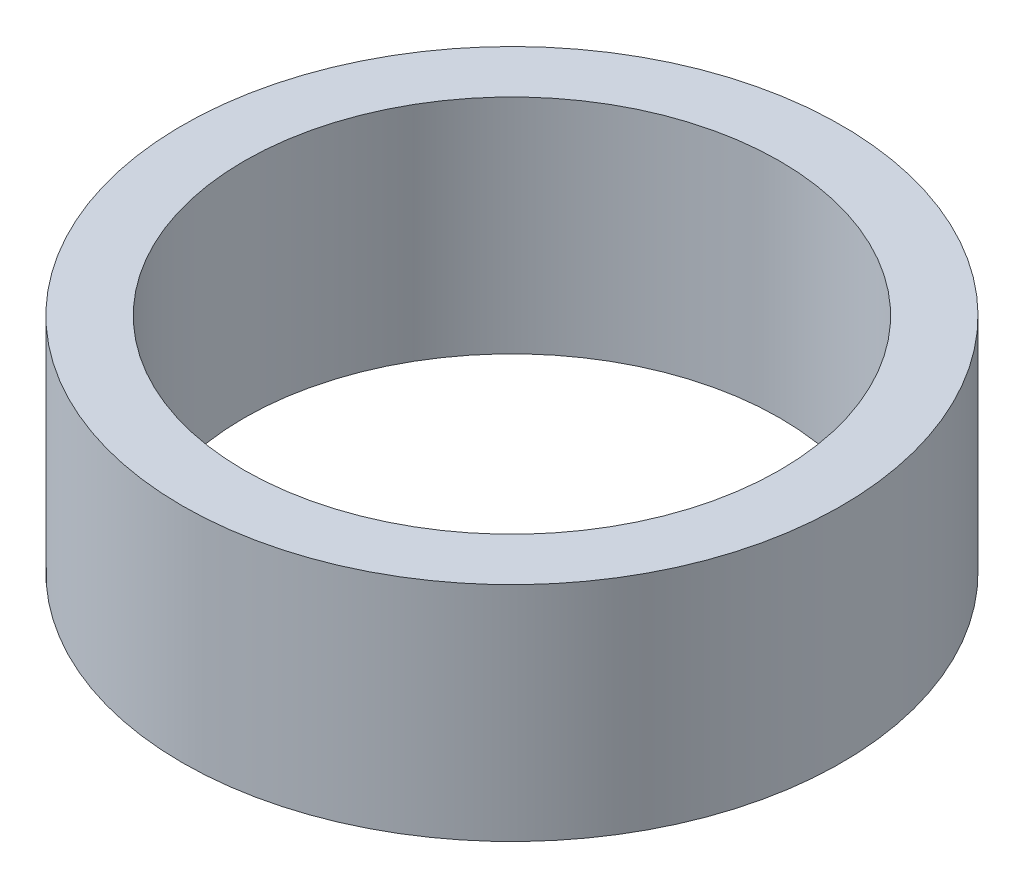
from build123d import *

# Parameters (mm, degrees)
SKETCH1_R           = 40
BOSS_EXTRUDE1_DEPTH = 27
SKETCH2_R           = 32.5
CUT_EXTRUDE1_DEPTH  = 63.681735777


with BuildPart() as part:
    # Sketch1 → Boss-Extrude1 (new body)
    with BuildSketch(Plane(origin=(0, 0, 0), x_dir=(1, 0, 0), z_dir=(0, 1, 0))):
        Circle(SKETCH1_R)
    extrude(amount=BOSS_EXTRUDE1_DEPTH)

    # Sketch2 → Cut-Extrude1 (cut, through all)
    with BuildSketch(Plane(origin=(0, 0, 0), x_dir=(1, 0, 0), z_dir=(0, 1, 0))):
        Circle(SKETCH2_R)
    extrude(amount=CUT_EXTRUDE1_DEPTH, mode=Mode.SUBTRACT)


solid = part.part
